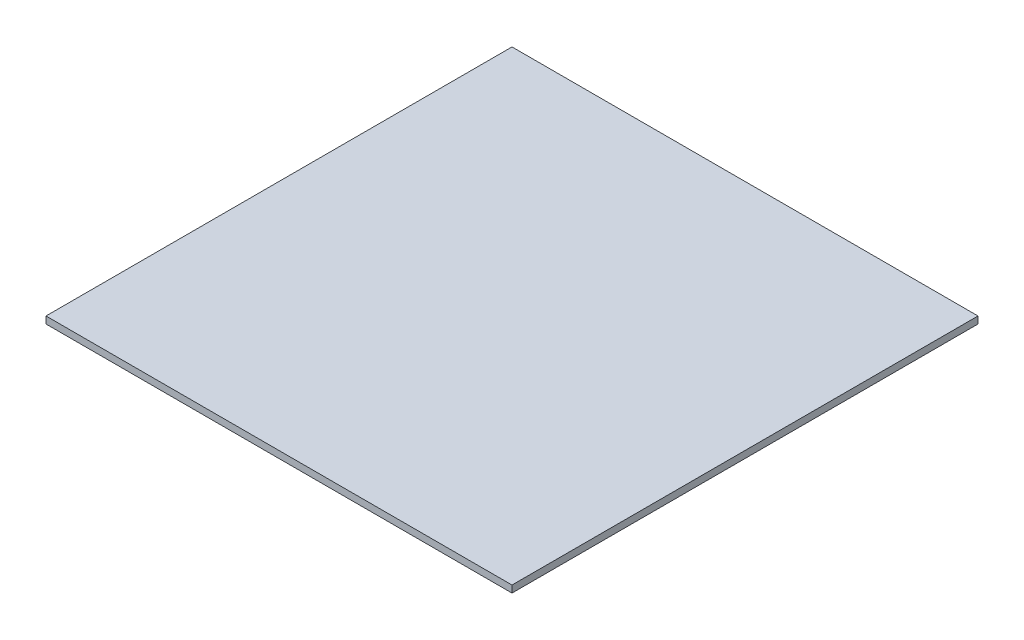
from build123d import *

# Parameters (mm, degrees)
SKETCH1_W           = 200
SKETCH1_H           = 200
BOSS_EXTRUDE1_DEPTH = 3


with BuildPart() as part:
    # Sketch1 → Boss-Extrude1 (new body)
    with BuildSketch(Plane(origin=(0, 0, 0), x_dir=(1, 0, 0), z_dir=(0, 1, 0))):
        with Locations((100, 100)):
            Rectangle(SKETCH1_W, SKETCH1_H)
    extrude(amount=BOSS_EXTRUDE1_DEPTH)


solid = part.part
